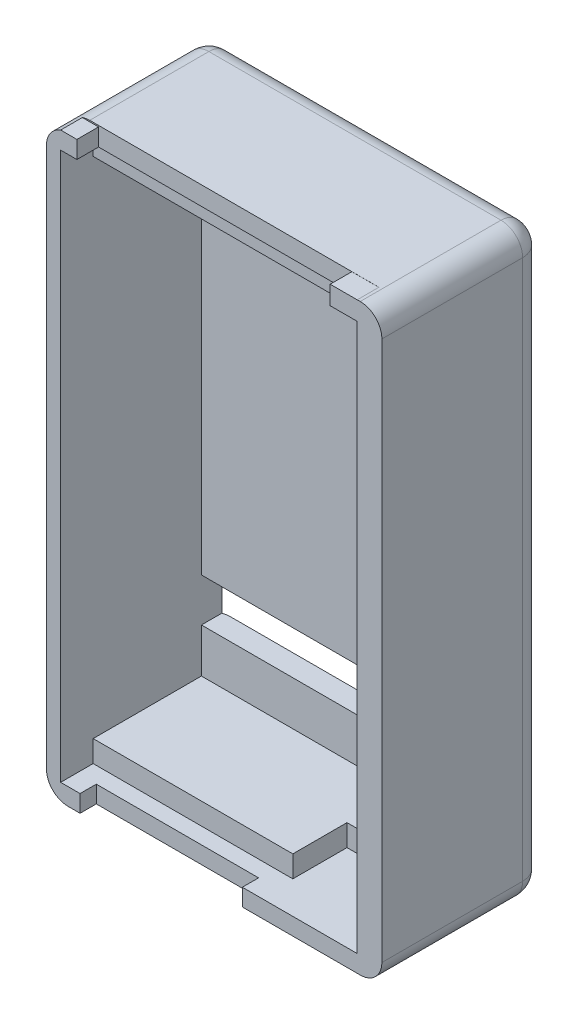
from build123d import *

# Parameters (mm, degrees)
SKETCH_3_W          = 30.97465329
SKETCH_3_H          = 53.868777402
EXTRUDE_1_DEPTH     = 15
SKETCH_5_W          = 27.381586342
SKETCH_5_H          = 50.559171176
CUT_EXTRUDE_1_DEPTH = 13
SKETCH_6_W          = 27.381586342
SKETCH_6_H          = 2
EXTRUDE_2_DEPTH     = 10
SKETCH_9_W          = 27.390957387
SKETCH_9_H          = 1.728490609
CUT_EXTRUDE_3_DEPTH = 2
FILLET_1_R          = 2
SKETCH_11_W         = 27.381586342
SKETCH_11_H         = 4
CUT_EXTRUDE_4_DEPTH = 10
SKETCH_12_W         = 6.049826212
SKETCH_12_H         = 2
CUT_EXTRUDE_5_DEPTH = 5
SKETCH_14_W         = 1.5
SKETCH_14_H         = 1.606542801
SKETCH_14_W_2       = 2.5
SKETCH_14_H_2       = 1.721797648
EXTRUDE_3_DEPTH     = 2
SKETCH_17_W         = 14.984382514
SKETCH_17_H         = 1.6
CUT_EXTRUDE_8_DEPTH = 1.5
FILLET_2_R          = 2


with BuildPart() as part:
    # 草图3 → 凸台-拉伸1 (new body)
    with BuildSketch(Plane.XY):
        with Locations((52.588905184, -51.822040042)):
            Rectangle(SKETCH_3_W, SKETCH_3_H)
    extrude(amount=EXTRUDE_1_DEPTH)

    # 草图5 → 切除-拉伸1 (cut)
    with BuildSketch(Plane.XY.offset(15)):
        with Locations((52.104679946, -51.895727538)):
            Rectangle(SKETCH_5_W, SKETCH_5_H)
    extrude(amount=-CUT_EXTRUDE_1_DEPTH, mode=Mode.SUBTRACT)

    # 草图6 → 凸台-拉伸2 (add)
    with BuildSketch(Plane.XY.offset(2)):
        with Locations((52.104679946, -27.61614195)):
            Rectangle(SKETCH_6_W, SKETCH_6_H)
        with Locations((52.104679946, -76.175313126)):
            Rectangle(SKETCH_6_W, SKETCH_6_H)
    extrude(amount=EXTRUDE_2_DEPTH)

    # 草图9 → 切除-拉伸3 (cut)
    with BuildSketch(Plane.XY.offset(15)):
        with Locations((52.109365469, -25.751896646)):
            Rectangle(SKETCH_9_W, SKETCH_9_H)
    extrude(amount=-CUT_EXTRUDE_3_DEPTH, mode=Mode.SUBTRACT)

    # 圆角1
    fillet_1_edges = [part.edges().sort_by_distance(p)[0] for p in [
        (68.076231829, -78.756428743, 7.5),
        (37.101578539, -78.756428743, 7.5),
        (37.101578539, -24.887651341, 7.5),
        (68.076231829, -24.887651341, 7.5),
    ]]
    fillet(fillet_1_edges, radius=FILLET_1_R)

    # 草图11 → 切除-拉伸4 (cut)
    with BuildSketch(Plane.XY.offset(2)):
        with Locations((52.104679946, -34.827114549)):
            Rectangle(SKETCH_11_W, SKETCH_11_H)
        with Locations((52.104679946, -69.090328525)):
            Rectangle(SKETCH_11_W, SKETCH_11_H)
    extrude(amount=-CUT_EXTRUDE_4_DEPTH, mode=Mode.SUBTRACT)

    # 草图12 → 切除-拉伸5 (cut)
    with BuildSketch(Plane.XY.offset(12)):
        with Locations((59.879933224, -76.175313126)):
            Rectangle(SKETCH_12_W, SKETCH_12_H)
    extrude(amount=-CUT_EXTRUDE_5_DEPTH, mode=Mode.SUBTRACT)

    # 草图14 → 凸台-拉伸3 (add)
    with BuildSketch(Plane.XY.offset(13)):
        with Locations((39.163886775, -25.81287055)):
            Rectangle(SKETCH_14_W, SKETCH_14_H)
        with Locations((64.554844162, -25.755243126)):
            Rectangle(SKETCH_14_W_2, SKETCH_14_H_2)
    extrude(amount=EXTRUDE_3_DEPTH)

    # 草图17 → 切除-拉伸8 (cut)
    with BuildSketch(Plane.XY.offset(15)):
        with Locations((47.697888967, -77.956428743)):
            Rectangle(SKETCH_17_W, SKETCH_17_H)
    extrude(amount=-CUT_EXTRUDE_8_DEPTH, mode=Mode.SUBTRACT)

    # 圆角2
    # the kernel refuses this fillet: 2 mm, written as the material it takes off along each edge
    with BuildSketch(Plane(origin=(39.101578539, -26.887651341, 0), x_dir=(0, 1, 0), z_dir=(1, 0, 0))) as fillet_2_piece_1:
        with BuildLine():
            CenterArc((2 - FILLET_2_R, FILLET_2_R), FILLET_2_R, 270, 90)
            Line((2, FILLET_2_R), (2, 0))
            Line((2, 0), (2 - FILLET_2_R, 0))
        make_face()
    revolve(axis=Axis((39.101578539, -26.887651341, 0), (0, 0, 1)), revolution_arc=90, mode=Mode.SUBTRACT)
    with BuildSketch(Plane(origin=(37.101578539, -76.756428743, 0), x_dir=(1, 0, 0), z_dir=(0, 1, 0)), Plane(origin=(68.076231829, -26.887651341, 0), x_dir=(-1, 0, 0), z_dir=(0, -1, 0))) as fillet_2_piece_2:
        with BuildLine():
            CenterArc((FILLET_2_R, -FILLET_2_R), FILLET_2_R, 90, 90)
            Line((0, -FILLET_2_R), (0, 0))
            Line((0, 0), (FILLET_2_R, 0))
        make_face()
    extrude(amount=49.868777401, mode=Mode.SUBTRACT)
    with BuildSketch(Plane(origin=(39.101578539, -76.756428743, 0), x_dir=(-1, 0, 0), z_dir=(0, 1, 0))) as fillet_2_piece_3:
        with BuildLine():
            CenterArc((2 - FILLET_2_R, FILLET_2_R), FILLET_2_R, 270, 90)
            Line((2, FILLET_2_R), (2, 0))
            Line((2, 0), (2 - FILLET_2_R, 0))
        make_face()
    revolve(axis=Axis((39.101578539, -76.756428743, 0), (0, 0, 1)), revolution_arc=90, mode=Mode.SUBTRACT)
    with BuildSketch(Plane(origin=(66.076231829, -78.756428743, 0), x_dir=(0, 1, 0), z_dir=(-1, 0, 0))) as fillet_2_piece_4:
        with BuildLine():
            CenterArc((FILLET_2_R, -FILLET_2_R), FILLET_2_R, 90, 90)
            Line((0, -FILLET_2_R), (0, 0))
            Line((0, 0), (FILLET_2_R, 0))
        make_face()
    extrude(amount=26.974653289, mode=Mode.SUBTRACT)
    with BuildSketch(Plane(origin=(66.076231829, -76.756428743, 0), x_dir=(0, -1, 0), z_dir=(-1, 0, 0))) as fillet_2_piece_5:
        with BuildLine():
            CenterArc((2 - FILLET_2_R, FILLET_2_R), FILLET_2_R, 270, 90)
            Line((2, FILLET_2_R), (2, 0))
            Line((2, 0), (2 - FILLET_2_R, 0))
        make_face()
    revolve(axis=Axis((66.076231829, -76.756428743, 0), (0, 0, 1)), revolution_arc=90, mode=Mode.SUBTRACT)
    with BuildSketch(Plane(origin=(66.076231829, -26.887651341, 0), x_dir=(0, 1, 0), z_dir=(-1, 0, 0))) as fillet_2_piece_6:
        with BuildLine():
            CenterArc((2 - FILLET_2_R, -FILLET_2_R), FILLET_2_R, 0, 90)
            Line((2, -FILLET_2_R), (2, 0))
            Line((2, 0), (2 - FILLET_2_R, 0))
        make_face()
    revolve(axis=Axis((66.076231829, -26.887651341, 0), (0, 0, -1)), revolution_arc=90, mode=Mode.SUBTRACT)
    with BuildSketch(Plane(origin=(39.101578539, -24.887651341, 0), x_dir=(0, 0, 1), z_dir=(1, 0, 0))) as fillet_2_piece_7:
        with BuildLine():
            CenterArc((FILLET_2_R, FILLET_2_R), FILLET_2_R, 180, 90)
            Line((0, FILLET_2_R), (0, 0))
            Line((0, 0), (FILLET_2_R, 0))
        make_face()
    extrude(amount=26.974653289, mode=Mode.SUBTRACT)


solid = part.part
